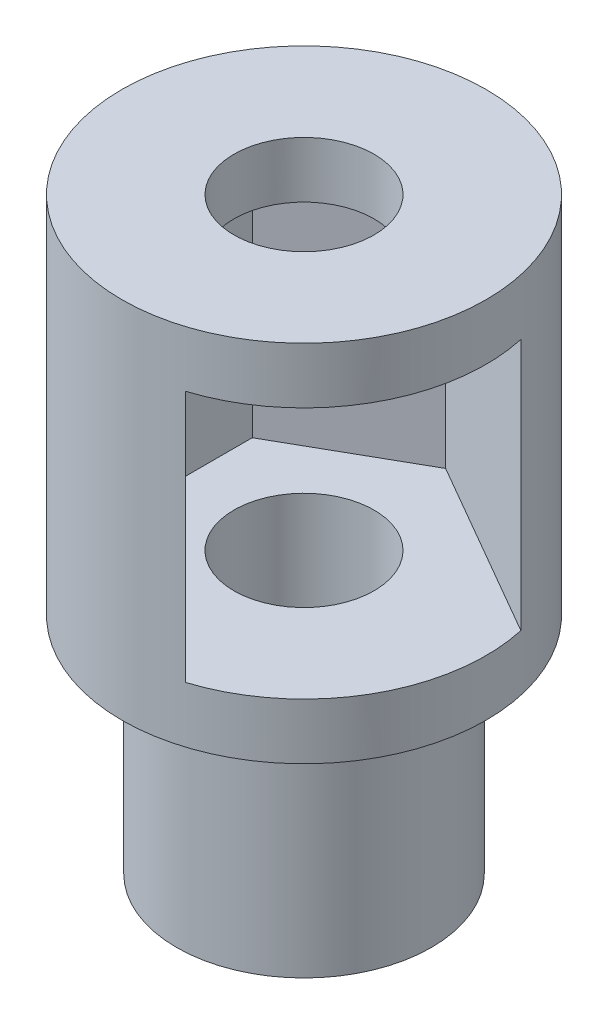
from build123d import *

# Parameters (mm, degrees)
SKETCH1_R           = 4.55
BOSS_EXTRUDE1_DEPTH = 8
SKETCH2_R           = 2.5
CUT_EXTRUDE1_DEPTH  = 8
SKETCH3_R           = 6.5
BOSS_EXTRUDE4_DEPTH = 11
CUT_EXTRUDE2_DEPTH  = 9
SKETCH6_R           = 6.5
BOSS_EXTRUDE5_DEPTH = 2
SKETCH7_R           = 2.5
CUT_EXTRUDE3_DEPTH  = 23.923786773


with BuildPart() as part:
    # Sketch1 → Boss-Extrude1 (new body)
    with BuildSketch(Plane(origin=(0, 0, 0), x_dir=(1, 0, 0), z_dir=(0, 1, 0))):
        Circle(SKETCH1_R)
    extrude(amount=BOSS_EXTRUDE1_DEPTH)

    # Sketch2 → Cut-Extrude1 (cut)
    with BuildSketch(Plane(origin=(0, 8, 0), x_dir=(1, 0, 0), z_dir=(0, 1, 0))):
        Circle(SKETCH2_R)
    extrude(amount=-CUT_EXTRUDE1_DEPTH, mode=Mode.SUBTRACT)

    # Sketch3 → Boss-Extrude4 (add)
    with BuildSketch(Plane(origin=(0, 8, 0), x_dir=(1, 0, 0), z_dir=(0, 1, 0))):
        Circle(SKETCH3_R)
    extrude(amount=BOSS_EXTRUDE4_DEPTH)

    # Sketch5 → Cut-Extrude2 (cut)
    with BuildSketch(Plane(origin=(0, 19, 0), x_dir=(1, 0, 0), z_dir=(0, 1, 0))):
        Polygon((-4.406153459, -2.521016119), (-4.406153459, 2.55966625), (-0.006153459, 5.061357304), (7.819258761, 0.543353452), (3.435994759, -7.048682503), align=None)
    extrude(amount=-CUT_EXTRUDE2_DEPTH, mode=Mode.SUBTRACT)

    # Sketch6 → Boss-Extrude5 (add)
    with BuildSketch(Plane(origin=(0, 19, 0), x_dir=(1, 0, 0), z_dir=(0, 1, 0))):
        Circle(SKETCH6_R)
    extrude(amount=BOSS_EXTRUDE5_DEPTH)

    # Sketch7 → Cut-Extrude3 (cut, through all)
    with BuildSketch(Plane.XZ):
        Circle(SKETCH7_R)
    extrude(amount=-CUT_EXTRUDE3_DEPTH, mode=Mode.SUBTRACT)


solid = part.part
